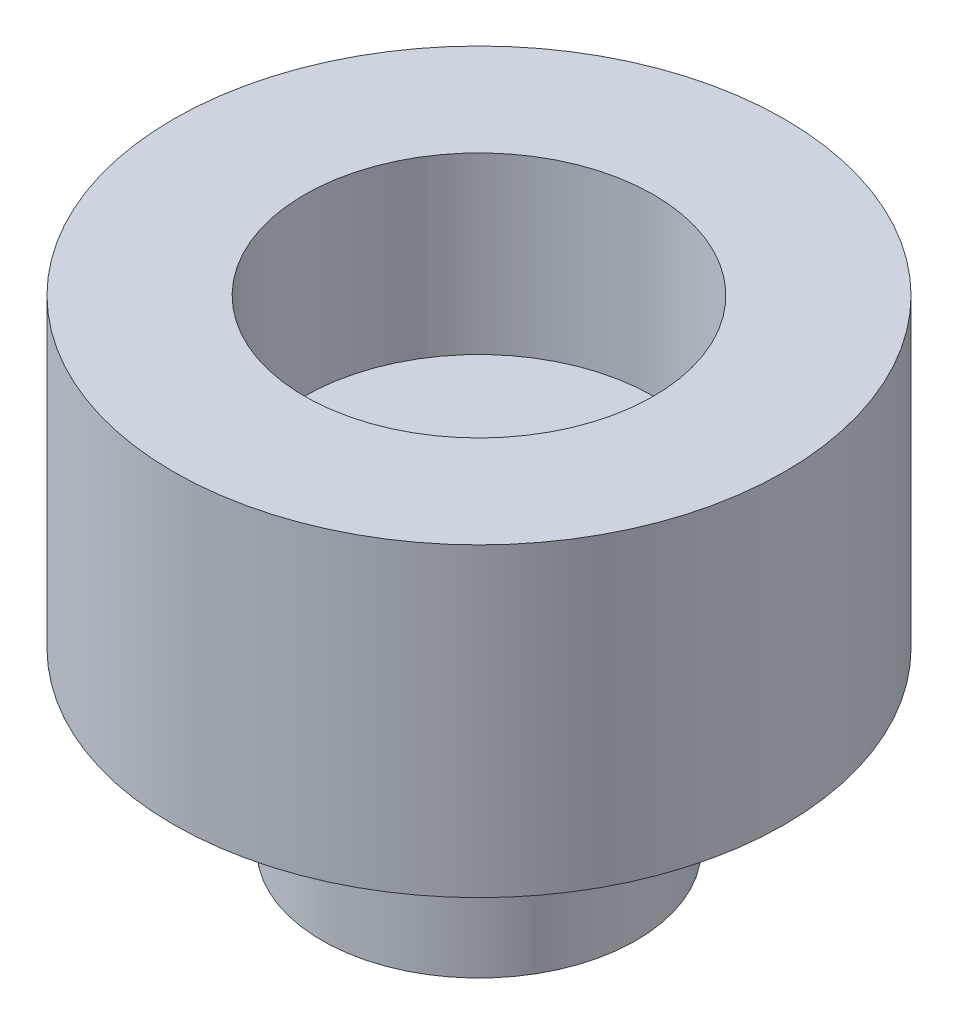
from build123d import *


with BuildPart() as part:
    # Esquisse1 → Révolution1 (revolve)
    with BuildSketch(Plane.XY):
        Polygon((0, 0), (0, 3.5), (2, 3.5), (2, 5.5), (3.5, 5.5), (3.5, 2), (1.8, 2), (1.8, 0), align=None)
    revolve(axis=Axis((0, 0, 0), (0, 1, 0)))


solid = part.part
